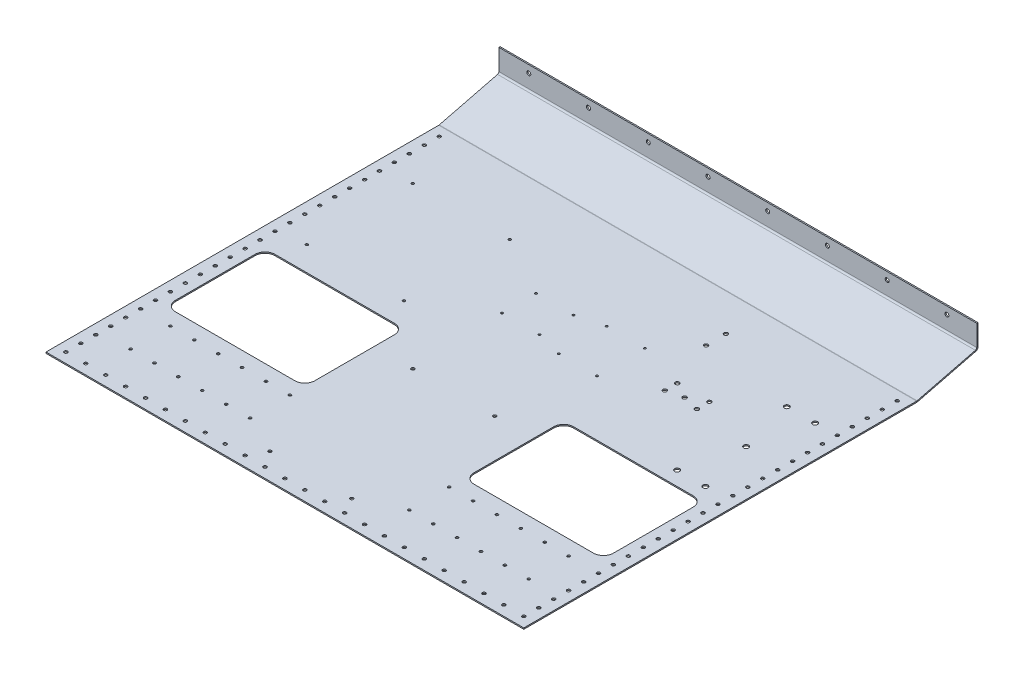
from build123d import *

# Parameters (mm, degrees)
SKETCH1_W                    = 609.6
SKETCH1_H                    = 501.65
BOSS_EXTRUDE1_DEPTH          = 0.79375
SKETCH2_W                    = 177.8
SKETCH2_H                    = 127
CUT_EXTRUDE1_DEPTH           = 395.738826037
SKETCH3_R                    = 2.0828
CUT_EXTRUDE2_DEPTH           = 395.738826037
FILLET1_R                    = 12.7
SKETCH4_R                    = 2.0828
CUT_EXTRUDE3_DEPTH           = 395.738826037
BOSS_EXTRUDE2_DEPTH          = 609.6
SKETCH6_R                    = 2.5527
CUT_EXTRUDE4_DEPTH           = 657.502270946
CONVERT_SOLID1_START         = -304.8
CONVERT_SOLID1_DEPTH         = 609.6
CONVERT_SOLID1_2_DEPTH       = 609.6
F_8_32_TAPPED_HOLE1_D        = 3.4544
F_10_32_TAPPED_HOLE1_D       = 4.0386
F_4_CLEARANCE_HOLE1_D        = 3.2639
F_6_32_TAPPED_HOLE1_D        = 2.7051
F_10_0_1935_DIAMETER_HOLE1_D = 4.9149
F_1_4_0_25_DIAMETER_HOLE1_D  = 6.35
F_8_0_199_DIAMETER_HOLE1_D   = 5.0546


# Read off the part's stored shape, not the designer's step: Convert-Solid1
with BuildPart() as part:
    # Sketch1 → Boss-Extrude1 (new, symmetric)
    with BuildSketch(Plane(origin=(0, 0, 0), x_dir=(1, 0, 0), z_dir=(0, 1, 0))):
        Rectangle(SKETCH1_W, SKETCH1_H)
    extrude(amount=BOSS_EXTRUDE1_DEPTH, both=True)

    # Sketch2 → Cut-Extrude1 (cut, through all)
    with BuildSketch(Plane(origin=(0, 0.79375, 0), x_dir=(1, 0, 0), z_dir=(0, 1, 0))):
        with Locations((190.5, -60.325)):
            Rectangle(SKETCH2_W, SKETCH2_H)
        with Locations((-190.5, -60.325)):
            Rectangle(SKETCH2_W, SKETCH2_H)
    extrude(amount=-CUT_EXTRUDE1_DEPTH, mode=Mode.SUBTRACT)

    # Sketch3 → Cut-Extrude2 (cut, through all)
    with BuildSketch(Plane(origin=(0, 0.79375, 0), x_dir=(1, 0, 0), z_dir=(0, 1, 0))):
        with Locations(Location((-292.1, 238.125, 0), (0, 0, 270))):
            Circle(SKETCH3_R)
        with Locations(Location((-292.1, 219.075, 0), (0, 0, 270))):
            Circle(SKETCH3_R)
        with Locations(Location((-292.1, 200.025, 0), (0, 0, 270))):
            Circle(SKETCH3_R)
        with Locations(Location((-292.1, 180.975, 0), (0, 0, 270))):
            Circle(SKETCH3_R)
        with Locations(Location((-292.1, 161.925, 0), (0, 0, 270))):
            Circle(SKETCH3_R)
        with Locations(Location((-292.1, 142.875, 0), (0, 0, 270))):
            Circle(SKETCH3_R)
        with Locations(Location((-292.1, 123.825, 0), (0, 0, 270))):
            Circle(SKETCH3_R)
        with Locations(Location((-292.1, 104.775, 0), (0, 0, 270))):
            Circle(SKETCH3_R)
        with Locations(Location((-292.1, 85.725, 0), (0, 0, 270))):
            Circle(SKETCH3_R)
        with Locations(Location((-292.1, 66.675, 0), (0, 0, 270))):
            Circle(SKETCH3_R)
        with Locations(Location((-292.1, 47.625, 0), (0, 0, 270))):
            Circle(SKETCH3_R)
        with Locations(Location((-292.1, 28.575, 0), (0, 0, 270))):
            Circle(SKETCH3_R)
        with Locations(Location((-292.1, 9.525, 0), (0, 0, 270))):
            Circle(SKETCH3_R)
        with Locations(Location((-292.1, -9.525, 0), (0, 0, 270))):
            Circle(SKETCH3_R)
        with Locations(Location((-292.1, -28.575, 0), (0, 0, 270))):
            Circle(SKETCH3_R)
        with Locations(Location((-292.1, -47.625, 0), (0, 0, 270))):
            Circle(SKETCH3_R)
        with Locations(Location((-292.1, -66.675, 0), (0, 0, 270))):
            Circle(SKETCH3_R)
        with Locations(Location((-292.1, -85.725, 0), (0, 0, 270))):
            Circle(SKETCH3_R)
        with Locations(Location((-292.1, -104.775, 0), (0, 0, 270))):
            Circle(SKETCH3_R)
        with Locations(Location((-292.1, -123.825, 0), (0, 0, 270))):
            Circle(SKETCH3_R)
        with Locations(Location((-292.1, -142.875, 0), (0, 0, 270))):
            Circle(SKETCH3_R)
        with Locations(Location((-292.1, -161.925, 0), (0, 0, 270))):
            Circle(SKETCH3_R)
        with Locations(Location((-292.1, -180.975, 0), (0, 0, 270))):
            Circle(SKETCH3_R)
        with Locations(Location((-292.1, -200.025, 0), (0, 0, 270))):
            Circle(SKETCH3_R)
        with Locations(Location((-292.1, -219.075, 0), (0, 0, 270))):
            Circle(SKETCH3_R)
        with Locations(Location((-292.1, -238.125, 0), (0, 0, 270))):
            Circle(SKETCH3_R)
        with Locations(Location((292.1, 47.625, 0), (0, 0, 90))):
            Circle(SKETCH3_R)
        with Locations(Location((292.1, 66.675, 0), (0, 0, 90))):
            Circle(SKETCH3_R)
        with Locations(Location((292.1, 85.725, 0), (0, 0, 90))):
            Circle(SKETCH3_R)
        with Locations(Location((292.1, 104.775, 0), (0, 0, 90))):
            Circle(SKETCH3_R)
        with Locations(Location((292.1, 123.825, 0), (0, 0, 90))):
            Circle(SKETCH3_R)
        with Locations(Location((292.1, 142.875, 0), (0, 0, 90))):
            Circle(SKETCH3_R)
        with Locations(Location((292.1, 28.575, 0), (0, 0, 90))):
            Circle(SKETCH3_R)
        with Locations(Location((292.1, 9.525, 0), (0, 0, 90))):
            Circle(SKETCH3_R)
        with Locations(Location((292.1, -9.525, 0), (0, 0, 90))):
            Circle(SKETCH3_R)
        with Locations(Location((292.1, -28.575, 0), (0, 0, 90))):
            Circle(SKETCH3_R)
        with Locations(Location((292.1, -47.625, 0), (0, 0, 90))):
            Circle(SKETCH3_R)
        with Locations(Location((292.1, -66.675, 0), (0, 0, 90))):
            Circle(SKETCH3_R)
        with Locations(Location((292.1, -85.725, 0), (0, 0, 90))):
            Circle(SKETCH3_R)
        with Locations(Location((292.1, -104.775, 0), (0, 0, 90))):
            Circle(SKETCH3_R)
        with Locations(Location((292.1, -123.825, 0), (0, 0, 90))):
            Circle(SKETCH3_R)
        with Locations(Location((292.1, -142.875, 0), (0, 0, 90))):
            Circle(SKETCH3_R)
        with Locations(Location((292.1, -161.925, 0), (0, 0, 90))):
            Circle(SKETCH3_R)
        with Locations(Location((292.1, -180.975, 0), (0, 0, 90))):
            Circle(SKETCH3_R)
        with Locations(Location((292.1, -200.025, 0), (0, 0, 90))):
            Circle(SKETCH3_R)
        with Locations(Location((292.1, -219.075, 0), (0, 0, 90))):
            Circle(SKETCH3_R)
        with Locations(Location((292.1, -238.125, 0), (0, 0, 90))):
            Circle(SKETCH3_R)
        with Locations(Location((292.1, 161.925, 0), (0, 0, 90))):
            Circle(SKETCH3_R)
        with Locations(Location((292.1, 180.975, 0), (0, 0, 90))):
            Circle(SKETCH3_R)
        with Locations(Location((292.1, 200.025, 0), (0, 0, 90))):
            Circle(SKETCH3_R)
        with Locations(Location((292.1, 219.075, 0), (0, 0, 90))):
            Circle(SKETCH3_R)
        with Locations(Location((292.1, 238.125, 0), (0, 0, 90))):
            Circle(SKETCH3_R)
    extrude(amount=-CUT_EXTRUDE2_DEPTH, mode=Mode.SUBTRACT)

    # Fillet1
    fillet1_edges = [part.edges().sort_by_distance(p)[0] for p in [
        (279.4, 0, -3.175),
        (279.4, 0, 123.825),
        (101.6, 0, 123.825),
        (101.6, 0, -3.175),
        (-101.6, 0, -3.175),
        (-101.6, 0, 123.825),
        (-279.4, 0, 123.825),
        (-279.4, 0, -3.175),
    ]]
    fillet(fillet1_edges, radius=FILLET1_R)

    # Sketch4 → Cut-Extrude3 (cut, through all)
    with BuildSketch(Plane(origin=(0, 0.79375, 0), x_dir=(1, 0, 0), z_dir=(0, 1, 0))):
        with Locations(Location((-266.7, -238.125, 0), (0, 0, 270))):
            Circle(SKETCH4_R)
        with Locations(Location((-241.3, -238.125, 0), (0, 0, 270))):
            Circle(SKETCH4_R)
        with Locations(Location((-215.9, -238.125, 0), (0, 0, 270))):
            Circle(SKETCH4_R)
        with Locations(Location((-190.5, -238.125, 0), (0, 0, 270))):
            Circle(SKETCH4_R)
        with Locations(Location((-165.1, -238.125, 0), (0, 0, 270))):
            Circle(SKETCH4_R)
        with Locations(Location((-139.7, -238.125, 0), (0, 0, 270))):
            Circle(SKETCH4_R)
        with Locations(Location((-114.3, -238.125, 0), (0, 0, 270))):
            Circle(SKETCH4_R)
        with Locations(Location((-88.9, -238.125, 0), (0, 0, 270))):
            Circle(SKETCH4_R)
        with Locations(Location((-63.5, -238.125, 0), (0, 0, 270))):
            Circle(SKETCH4_R)
        with Locations(Location((-38.1, -238.125, 0), (0, 0, 270))):
            Circle(SKETCH4_R)
        with Locations(Location((-12.7, -238.125, 0), (0, 0, 270))):
            Circle(SKETCH4_R)
        with Locations(Location((12.7, -238.125, 0), (0, 0, 270))):
            Circle(SKETCH4_R)
        with Locations(Location((38.1, -238.125, 0), (0, 0, 270))):
            Circle(SKETCH4_R)
        with Locations(Location((63.5, -238.125, 0), (0, 0, 270))):
            Circle(SKETCH4_R)
        with Locations(Location((88.9, -238.125, 0), (0, 0, 270))):
            Circle(SKETCH4_R)
        with Locations(Location((114.3, -238.125, 0), (0, 0, 270))):
            Circle(SKETCH4_R)
        with Locations(Location((139.7, -238.125, 0), (0, 0, 270))):
            Circle(SKETCH4_R)
        with Locations(Location((165.1, -238.125, 0), (0, 0, 270))):
            Circle(SKETCH4_R)
        with Locations(Location((190.5, -238.125, 0), (0, 0, 270))):
            Circle(SKETCH4_R)
        with Locations(Location((215.9, -238.125, 0), (0, 0, 270))):
            Circle(SKETCH4_R)
        with Locations(Location((241.3, -238.125, 0), (0, 0, 270))):
            Circle(SKETCH4_R)
        with Locations(Location((266.7, -238.125, 0), (0, 0, 270))):
            Circle(SKETCH4_R)
    extrude(amount=-CUT_EXTRUDE3_DEPTH, mode=Mode.SUBTRACT)

    # Sketch5 → Boss-Extrude2 (add, through all)
    with BuildSketch(Plane(origin=(304.8, 0, 0), x_dir=(0, 0, -1), z_dir=(1, 0, 0))):
        Polygon((327.025, 48.41875), (327.025, 19.84375), (250.825, 0.79375), (250.825, -0.79375), (328.6125, 18.653125), (328.6125, 48.41875), align=None)
    extrude(amount=-BOSS_EXTRUDE2_DEPTH)

    # Sketch6 → Cut-Extrude4 (cut, through all)
    with BuildSketch(Plane(origin=(0, 0, -328.6125), x_dir=(-1, 0, 0), z_dir=(0, 0, -1))):
        with Locations((-266.7, 38.89375)):
            Circle(SKETCH6_R)
        with Locations((-190.5, 38.89375)):
            Circle(SKETCH6_R)
        with Locations((-114.3, 38.89375)):
            Circle(SKETCH6_R)
        with Locations((-38.1, 38.89375)):
            Circle(SKETCH6_R)
        with Locations((38.1, 38.89375)):
            Circle(SKETCH6_R)
        with Locations((114.3, 38.89375)):
            Circle(SKETCH6_R)
        with Locations((190.5, 38.89375)):
            Circle(SKETCH6_R)
        with Locations((266.7, 38.89375)):
            Circle(SKETCH6_R)
    extrude(amount=-CUT_EXTRUDE4_DEPTH, mode=Mode.SUBTRACT)

    # Convert-Solid1 outline → Convert-Solid1 (cut)
    with BuildSketch(Plane.YZ.offset(CONVERT_SOLID1_START)):
        with BuildLine():
            Line((-0.79375, -250.825), (-0.678096974, -251.287612103))
            ThreePointArc((-0.678096974, -251.287612103), (-0.764728021, -250.821427231), (-0.79375, -250.348150359))
            Line((-0.79375, -250.348150359), (-0.79375, -250.825))
        make_face()
        with BuildLine():
            ThreePointArc((21.67746241, -328.6125), (19.293663217, -327.792113764), (17.919615436, -325.678461744))
            Line((17.919615436, -325.678461744), (18.653125, -328.6125))
            Line((18.653125, -328.6125), (21.67746241, -328.6125))
        make_face()
    extrude(amount=CONVERT_SOLID1_DEPTH, mode=Mode.SUBTRACT)

    # Convert-Solid1 2 outline → Convert-Solid1 2 (add)
    with BuildSketch(Plane.YZ.offset(CONVERT_SOLID1_START)):
        with BuildLine():
            Line((19.459716655, -325.293436439), (0.862004245, -250.902586798))
            ThreePointArc((0.862004245, -250.902586798), (0.810877725, -250.6274613), (0.79375, -250.348150359))
            Line((0.79375, -250.348150359), (0.79375, -250.825))
            Line((0.79375, -250.825), (19.84375, -327.025))
            Line((19.84375, -327.025), (21.67746241, -327.025))
            ThreePointArc((21.67746241, -327.025), (20.2706301, -326.540837631), (19.459716655, -325.293436439))
        make_face()
    extrude(amount=CONVERT_SOLID1_2_DEPTH)

    # #8-32 Tapped Hole1 (through all)
    with Locations(Plane(origin=(0, 0.79375, 0), x_dir=(1, 0, 0), z_dir=(0, 1, 0))):
        with Locations((-254, -193.675), (-223.52, -193.675), (-193.04, -193.675), (-162.56, -193.675), (-132.08, -193.675), (-101.6, -193.675), (-223.52, -142.875), (-193.04, -142.875), (-162.56, -142.875), (-132.08, -142.875), (-101.6, -142.875), (-254, -142.875)):
            f_8_32_tapped_hole1 = Hole(F_8_32_TAPPED_HOLE1_D / 2)

    # Mirror1: #8-32 Tapped Hole1 across plane
    add(f_8_32_tapped_hole1.mirror(Plane(origin=(0, 0, 0), x_dir=(0, 0, 1), z_dir=(1, 0, 0))), mode=Mode.SUBTRACT)

    # #10-32 Tapped Hole1 (through all)
    with Locations(Plane(origin=(0, 0.79375, 0), x_dir=(1, 0, 0), z_dir=(0, 1, 0))):
        with Locations((-52.197, -217.678), (52.197, -217.678), (52.197, -35.4076), (-52.197, -35.4076)):
            Hole(F_10_32_TAPPED_HOLE1_D / 2)

    # #4 Clearance Hole1 (through all)
    with Locations(Plane(origin=(0, 0.79375, 0), x_dir=(1, 0, 0), z_dir=(0, 1, 0))):
        with Locations((-257.048, 34.0995), (-133.1722, 34.0995), (-133.1722, 169.2021), (-257.048, 169.2021)):
            Hole(F_4_CLEARANCE_HOLE1_D / 2)

    # #6-32 Tapped Hole1 (through all)
    with Locations(Plane(origin=(0, 0.79375, 0), x_dir=(1, 0, 0), z_dir=(0, 1, 0))):
        with Locations((-56.9722, 83.1596), (-56.9722, 126.3904), (-9.144, 126.3904), (-9.144, 83.1596), (24.3078, 74.2569), (73.152, 74.2569), (73.152, 135.2931), (24.3078, 135.2931)):
            Hole(F_6_32_TAPPED_HOLE1_D / 2)

    # #10 (0.1935) Diameter Hole1 (through all)
    with Locations(Plane(origin=(0, 0.79375, 0), x_dir=(1, 0, 0), z_dir=(0, 1, 0))):
        with Locations((108.9025, 202.946), (108.9025, 177.546)):
            Hole(F_10_0_1935_DIAMETER_HOLE1_D / 2)

    # 1/4 (0.25) Diameter Hole1 (through all)
    with Locations(Plane(origin=(0, 0.79375, 0), x_dir=(1, 0, 0), z_dir=(0, 1, 0))):
        with Locations((264.287, 21.336), (264.287, 161.29), (228.219, 21.336), (228.219, 161.29), (246.253, 91.313)):
            Hole(F_1_4_0_25_DIAMETER_HOLE1_D / 2)

    # #8 (0.199) Diameter Hole1 (through all)
    with Locations(Plane(origin=(0, 0.79375, 0), x_dir=(1, 0, 0), z_dir=(0, 1, 0))):
        with Locations((132.4229, 117.3734), (173.4185, 117.3734), (173.4185, 101.3714), (132.4229, 101.3714), (152.9207, 106.2228)):
            Hole(F_8_0_199_DIAMETER_HOLE1_D / 2)


solid = part.part
